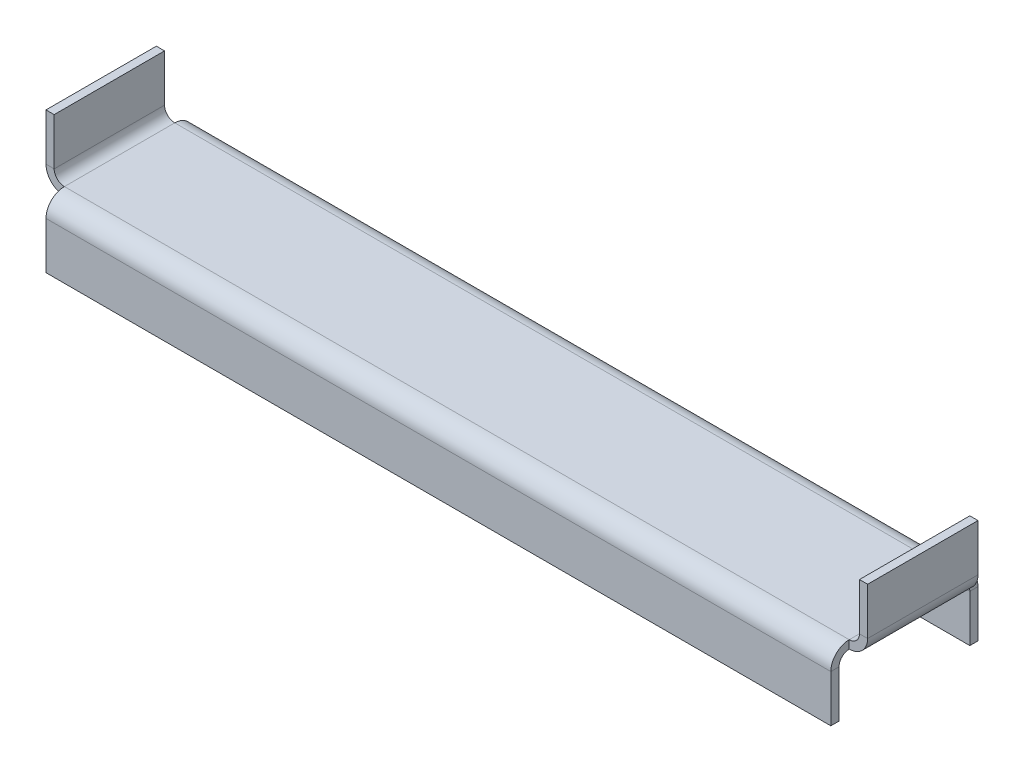
from build123d import *

# Parameters (mm, degrees)
BASE_FLANGE1_DEPTH      = 304.8
EDGE_FLANGE1_DEPTH      = 85.725
EDGE_FLANGE1_BEND_DEPTH = 85.725


# Sheet-metal steps are written as plain solids
with BuildPart() as part:
    # Sketch1 → Base-Flange1 (new, symmetric)
    with BuildSketch(Plane(origin=(0, 0, 0), x_dir=(0, 0, -1), z_dir=(1, 0, 0))):
        with BuildLine():
            Line((-57.15, -50.8), (-57.15, -14.2875))
            ThreePointArc((-57.15, -14.2875), (-52.965288136, -4.184711864), (-42.8625, 0))
            Line((-42.8625, 0), (42.8625, 0))
            ThreePointArc((42.8625, 0), (52.965288136, -4.184711864), (57.15, -14.2875))
            Line((57.15, -14.2875), (57.15, -50.8))
            Line((57.15, -50.8), (50.8, -50.8))
            Line((50.8, -50.8), (50.8, -14.2875))
            ThreePointArc((50.8, -14.2875), (48.475160076, -8.674839924), (42.8625, -6.35))
            Line((42.8625, -6.35), (-42.8625, -6.35))
            ThreePointArc((-42.8625, -6.35), (-48.475160076, -8.674839924), (-50.8, -14.2875))
            Line((-50.8, -14.2875), (-50.8, -50.8))
            Line((-50.8, -50.8), (-57.15, -50.8))
        make_face()
    extrude(amount=BASE_FLANGE1_DEPTH, both=True)

    # Edge-Flange1 section (across the edge) → Edge-Flange1 (add)
    with BuildSketch(Plane(origin=(312.7375, 0, 42.8625), x_dir=(-1, 0, 0), z_dir=(0, 0, -1))):
        with BuildLine():
            Line((-6.35, 7.9375), (-6.35, 44.45))
            Line((-6.35, 44.45), (0, 44.45))
            Line((0, 44.45), (0, 7.9375))
            ThreePointArc((0, 7.9375), (2.324839924, 2.324839924), (7.9375, 0))
            Line((7.9375, 0), (7.9375, -6.35))
            ThreePointArc((7.9375, -6.35), (-2.165288136, -2.165288136), (-6.35, 7.9375))
        make_face()
    extrude(amount=EDGE_FLANGE1_DEPTH)

    # Edge-Flange1 section 2 (across the edge) → Edge-Flange1 bend (add)
    with BuildSketch(Plane(origin=(-312.7375, 0, -42.8625), x_dir=(1, 0, 0), z_dir=(0, 0, 1))):
        with BuildLine():
            Line((-6.35, 7.9375), (-6.35, 44.45))
            Line((-6.35, 44.45), (0, 44.45))
            Line((0, 44.45), (0, 7.9375))
            ThreePointArc((0, 7.9375), (2.324839924, 2.324839924), (7.9375, 0))
            Line((7.9375, 0), (7.9375, -6.35))
            ThreePointArc((7.9375, -6.35), (-2.165288136, -2.165288136), (-6.35, 7.9375))
        make_face()
    extrude(amount=EDGE_FLANGE1_BEND_DEPTH)


solid = part.part
